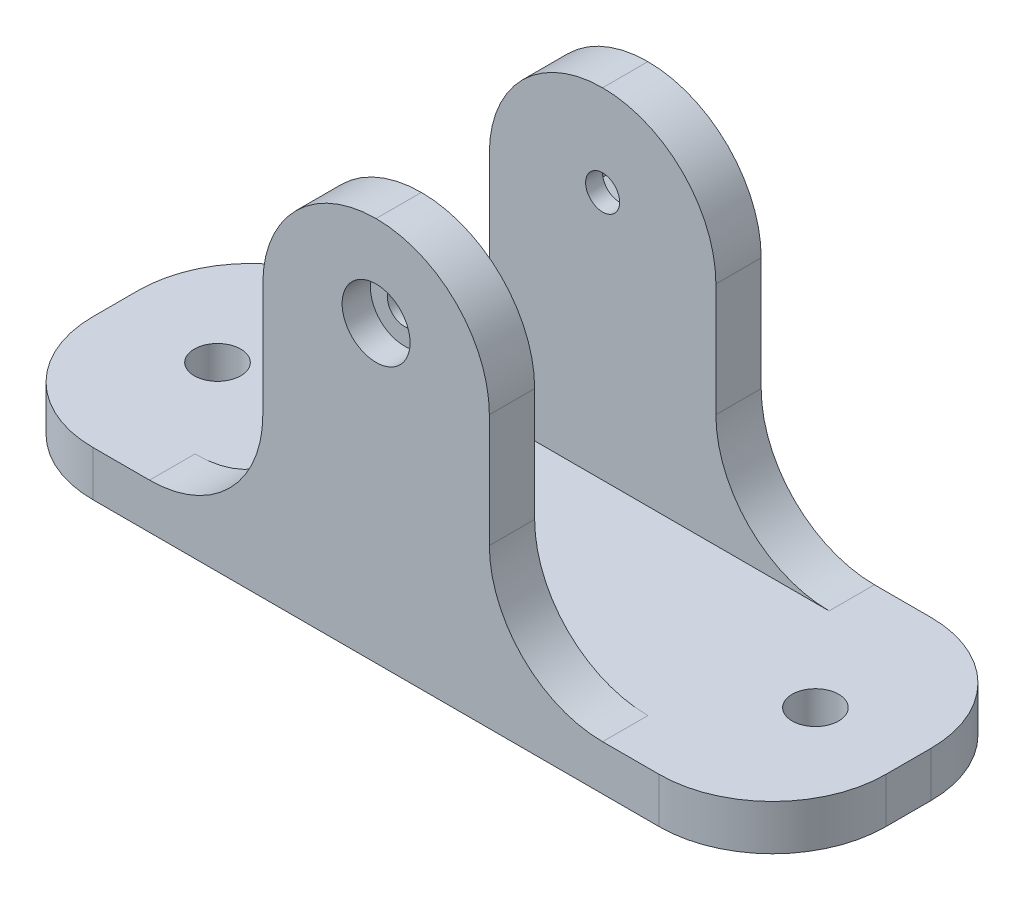
from build123d import *

# Parameters (mm, degrees)
SKETCH1_W           = 70
SKETCH1_H           = 24
BOSS_EXTRUDE1_DEPTH = 2
SKETCH2_W           = 20
SKETCH2_H           = 4
BOSS_EXTRUDE2_DEPTH = 30
FILLET1_R           = 10
FILLET2_R           = 10
CUT_EXTRUDE1_REACH  = 55.151
SKETCH3_R           = 1.5
FILLET3_R           = 10
SKETCH4_R           = 2.05
CUT_EXTRUDE2_DEPTH  = 4
SKETCH5_R           = 3
CUT_EXTRUDE3_DEPTH  = 2.5
CUT_EXTRUDE4_DEPTH  = 2.5


with BuildPart() as part:
    # Sketch1 → Boss-Extrude1 (new, symmetric)
    with BuildSketch(Plane(origin=(0, 0, 0), x_dir=(1, 0, 0), z_dir=(0, 1, 0))):
        Rectangle(SKETCH1_W, SKETCH1_H)
    extrude(amount=BOSS_EXTRUDE1_DEPTH, both=True)

    # Sketch2 → Boss-Extrude2 (add)
    with BuildSketch(Plane(origin=(0, 2, 0), x_dir=(1, 0, 0), z_dir=(0, 1, 0))):
        with Locations((0, 10)):
            Rectangle(SKETCH2_W, SKETCH2_H)
        with Locations((0, -10)):
            Rectangle(SKETCH2_W, SKETCH2_H)
    extrude(amount=BOSS_EXTRUDE2_DEPTH)

    # Fillet1
    fillet1_edges = [part.edges().sort_by_distance(p)[0] for p in [
        (-10, 2, -10),
        (10, 2, -10),
        (-10, 2, 10),
        (10, 2, 10),
    ]]
    fillet(fillet1_edges, radius=FILLET1_R)

    # Fillet2
    fillet2_edges = [part.edges().sort_by_distance(p)[0] for p in [
        (-10, 32, 10),
        (10, 32, 10),
        (10, 32, -10),
        (-10, 32, -10),
    ]]
    fillet(fillet2_edges, radius=FILLET2_R - 0.0001)  # a hair under: the kernel refuses the full size

    # Cut-Extrude1: up to this face of the body (flat: up to its plane)
    cut_extrude1_end = Plane(part.part.faces().sort_by_distance((0, 10.345619741, -12))[0])
    # Sketch3 → Cut-Extrude1 (cut, up to the picked face)
    with BuildSketch(Plane.XY.offset(12), mode=Mode.PRIVATE) as cut_extrude1_sk1:
        with Locations((0, 24)):
            Circle(SKETCH3_R)
    cut_extrude1_tool1 = split(extrude(cut_extrude1_sk1.sketch, amount=-CUT_EXTRUDE1_REACH, mode=Mode.PRIVATE), bisect_by=cut_extrude1_end, keep=Keep.BOTH, mode=Mode.PRIVATE)
    add(cut_extrude1_tool1.solids().sort_by(Axis((0, 24, 12), (0, 0, -1)))[0], mode=Mode.SUBTRACT)

    # Fillet3
    fillet3_edges = [part.edges().sort_by_distance(p)[0] for p in [
        (35, 0, 12),
        (-35, 0, 12),
        (-35, 0, -12),
        (35, 0, -12),
    ]]
    fillet(fillet3_edges, radius=FILLET3_R)

    # Sketch4 → Cut-Extrude2 (cut)
    with BuildSketch(Plane(origin=(0, 2, 0), x_dir=(1, 0, 0), z_dir=(0, 1, 0))):
        with Locations(Location((-26, 0, 0), (0, 0, 270))):
            Circle(SKETCH4_R)
        with Locations(Location((26.78915656, 0, 0), (0, 0, 270))):
            Circle(SKETCH4_R)
    extrude(amount=-CUT_EXTRUDE2_DEPTH, mode=Mode.SUBTRACT)

    # Sketch5 → Cut-Extrude3 (cut)
    with BuildSketch(Plane.XY.offset(12)):
        with Locations((0, 24)):
            Circle(SKETCH5_R)
    extrude(amount=-CUT_EXTRUDE3_DEPTH, mode=Mode.SUBTRACT)

    # Sketch6 → Cut-Extrude4 (cut)
    with BuildSketch(Plane(origin=(0, 0, -12), x_dir=(-1, 0, 0), z_dir=(0, 0, -1))):
        Polygon((2.75, 25.58771324), (0, 27.175426481), (-2.75, 25.58771324), (-2.75, 22.41228676), (0, 20.824573519), (2.75, 22.41228676), align=None)
    extrude(amount=-CUT_EXTRUDE4_DEPTH, mode=Mode.SUBTRACT)


solid = part.part
